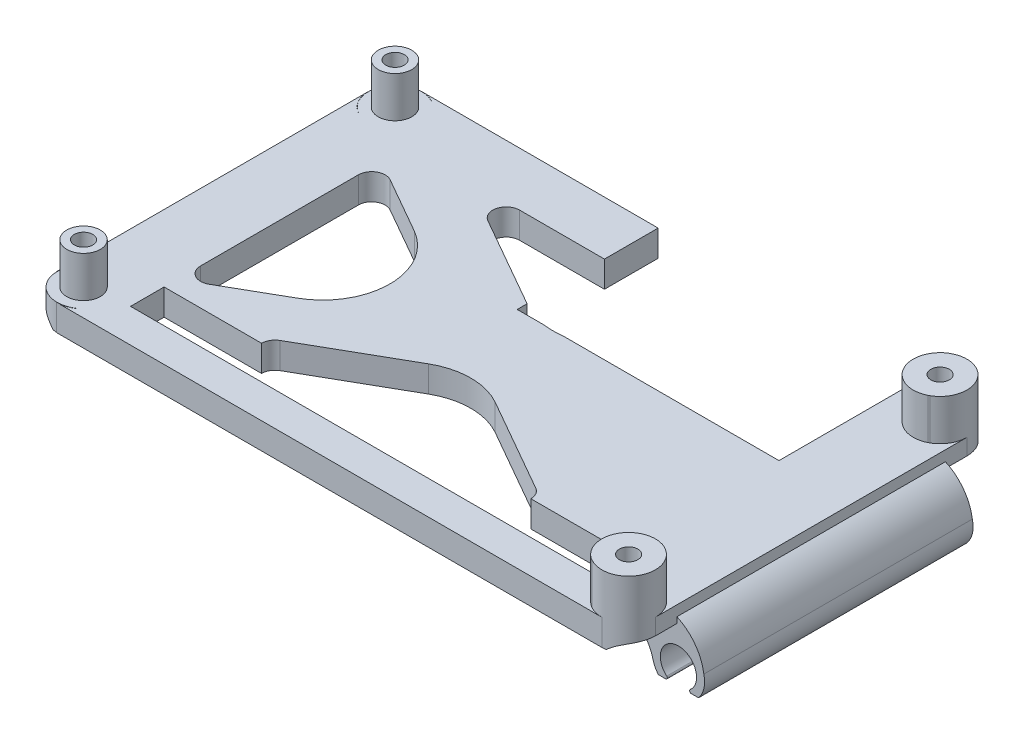
from build123d import *
from build123d.topology import SkipClean

# Parameters (mm, degrees)
EXTRUDE_1_DEPTH                            = 3.9
EXTRUDE_2_DEPTH                            = 10
EXTRUDE_3_DEPTH                            = 20
EXTRUDE_5_DEPTH                            = 20
FILLET_1_R                                 = 0.25
FILLET_1_OF_MIRROR_2_R                     = 0.25
SKETCH_7_R                                 = 5.5
CUT_EXTRUDE_3_DEPTH                        = 69.568655998
MIRROR_3_AT_THE_SECOND_PLANE_COPY_1_SKET_R = 5.5
MIRROR_3_AT_THE_SECOND_PLANE_COPY_1_DEPTH  = 69.568655998
SKETCH_8_W                                 = 70.7
SKETCH_8_H                                 = 5
CUT_EXTRUDE_4_DEPTH                        = 10
SKETCH_10_R                                = 1.375
CUT_EXTRUDE_5_DEPTH                        = 4
SKETCH_11_R                                = 1.375
CUT_EXTRUDE_6_DEPTH                        = 4
CUT_EXTRUDE_START                          = -6.1
SKETCH_12_R                                = 4
SKETCH_12_R_2                              = 2.5
CUT_EXTRUDE_7_DEPTH                        = 6.1


# Read off the part's stored shape, not the designer's step: Бобышка-Вытянуть2
with BuildPart() as part:
    # Эскиз1 → Бобышка-Вытянуть1 (new body)
    with BuildSketch(Plane(origin=(0, 0, 0), x_dir=(1, 0, 0), z_dir=(0, 1, 0))):
        with BuildLine():
            ThreePointArc((38.426306594, 26.557835162), (39.466717301, 27.036100927), (40.6, 27.2))
            Line((40.6, 27.2), (33.6, 27.2))
            Line((33.6, 27.2), (33.6, 14.604632239))
            Line((33.6, 14.604632239), (33.6, 6.2))
            Line((33.6, 6.2), (1.399354729, 6.2))
            ThreePointArc((1.399354729, 6.2), (0.006924966, 6.102582459), (-1.385504796, 6.2))
            Line((-1.385504796, 6.2), (-5.4, 6.2))
            Line((-5.4, 6.2), (-5.4, 7.674742799))
            Line((-5.4, 7.674742799), (-19.030349104, 15.463513716))
            ThreePointArc((-19.030349104, 15.463513716), (-19.971070525, 17.71333587), (-18.038071227, 19.2))
            Line((-18.038071227, 19.2), (-5.654645622, 19.2))
            Line((-5.654645622, 19.2), (-5.4, 19.2))
            Line((-5.4, 19.2), (-5.4, 27.2))
            Line((-5.4, 27.2), (-40.6, 27.2))
            ThreePointArc((-40.6, 27.2), (-39.40357152, 27.016878161), (-38.316689133, 26.484279447))
            ThreePointArc((-38.316689133, 26.484279447), (-37.055056879, 25.052937739), (-36.6, 23.2))
            ThreePointArc((-36.6, 23.2), (-38.441442008, 19.832415198), (-42.270313698, 19.565436457))
            ThreePointArc((-42.270313698, 19.565436457), (-43.967584802, 21.041442008), (-44.6, 23.2))
            Line((-44.6, 23.2), (-44.6, -23.2))
            ThreePointArc((-44.6, -23.2), (-43.898463936, -20.937228323), (-42.039932168, -19.468164614))
            ThreePointArc((-42.039932168, -19.468164614), (-38.337228323, -19.901536064), (-36.6, -23.2))
            ThreePointArc((-36.6, -23.2), (-36.999332896, -24.942181508), (-38.117598203, -26.336507822))
            ThreePointArc((-38.117598203, -26.336507822), (-39.285852232, -26.977964484), (-40.6, -27.2))
            Line((-40.6, -27.2), (40.6, -27.2))
            ThreePointArc((40.6, -27.2), (39.40357152, -27.016878161), (38.316689133, -26.484279447))
            ThreePointArc((38.316689133, -26.484279447), (37.127027431, -21.215444247), (42.270313698, -19.565436457))
            ThreePointArc((42.270313698, -19.565436457), (43.967584802, -21.041442008), (44.6, -23.2))
            Line((44.6, -23.2), (44.6, 23.2))
            ThreePointArc((44.6, 23.2), (44.004288219, 21.099804362), (42.394589141, 19.625164365))
            ThreePointArc((42.394589141, 19.625164365), (37.128485762, 21.212894343), (38.426306594, 26.557835162))
        make_face()
        with BuildLine():
            Line((-34.6, -11.764543277), (-34.6, 11.736040701))
            ThreePointArc((-34.6, 11.736040701), (-33.603853636, 13.465860887), (-31.607722123, 13.472526985))
            Line((-31.607722123, 13.472526985), (-23.204254649, 8.670545572))
            ThreePointArc((-23.204254649, 8.670545572), (-18.165644258, -0.009764783), (-23.200571892, -8.692211802))
            Line((-23.200571892, -8.692211802), (-31.606985572, -13.500608467))
            ThreePointArc((-31.606985572, -13.500608467), (-33.603486707, -13.494576348), (-34.6, -11.764543277))
        make_face(mode=Mode.SUBTRACT)
        with BuildLine():
            Line((-5.654645622, -19.2), (-18.078829772, -19.2))
            ThreePointArc((-18.078829772, -19.2), (-20.011937899, -17.712925891), (-19.070370981, -15.46309297))
            Line((-19.070370981, -15.46309297), (-4.97114598, -7.414324467))
            ThreePointArc((-4.97114598, -7.414324467), (-0.011319049, -6.098859843), (4.947949446, -7.416428197))
            Line((4.947949446, -7.416428197), (19.030349104, -15.463513716))
            ThreePointArc((19.030349104, -15.463513716), (19.971070525, -17.71333587), (18.038071227, -19.2))
            Line((18.038071227, -19.2), (4.894026582, -19.2))
            Line((4.894026582, -19.2), (-5.654645622, -19.2))
        make_face(mode=Mode.SUBTRACT)
    extrude(amount=EXTRUDE_1_DEPTH)

    # Бобышка-Вытянуть2 outline → Бобышка-Вытянуть2 (add)
    with BuildSketch(Plane(origin=(0, 0, 0), x_dir=(1, 0, 0), z_dir=(0, 1, 0))):
        with BuildLine():
            ThreePointArc((-42.607209829, -19.79264258), (-44.020115702, -25.185392776), (-38.636505369, -26.632734292))
            Line((-38.636505369, -26.632734292), (-38.117598203, -26.336507822))
            ThreePointArc((-38.117598203, -26.336507822), (-37.126497396, -21.216372096), (-42.039932168, -19.468164614))
            Line((-42.039932168, -19.468164614), (-42.607209829, -19.79264258))
        make_face()
        with BuildLine():
            ThreePointArc((38.426306594, 26.557835162), (37.128485762, 21.212894342), (42.394589141, 19.625164365))
            Line((42.394589141, 19.625164365), (42.583191096, 19.732830813))
            ThreePointArc((42.583191096, 19.732830813), (44.05455341, 25.20508599), (38.573099365, 26.641799371))
            Line((38.573099365, 26.641799371), (38.426306594, 26.557835162))
        make_face()
        with BuildLine():
            Line((-42.576812283, 19.740578505), (-42.270313698, 19.565436457))
            ThreePointArc((-42.270313698, 19.565436457), (-37.127027432, 21.215444247), (-38.316689133, 26.484279447))
            Line((-38.316689133, 26.484279447), (-38.623187717, 26.659421495))
            ThreePointArc((-38.623187717, 26.659421495), (-44.059421495, 25.176812283), (-42.576812283, 19.740578505))
        make_face()
        with BuildLine():
            Line((38.316689133, -26.484279447), (38.623187717, -26.659421495))
            ThreePointArc((38.623187717, -26.659421495), (44.059421495, -25.176812283), (42.576812283, -19.740578505))
            Line((42.576812283, -19.740578505), (42.270313698, -19.565436457))
            ThreePointArc((42.270313698, -19.565436457), (37.127027431, -21.215444247), (38.316689133, -26.484279447))
        make_face()
    extrude(amount=EXTRUDE_2_DEPTH)



with BuildPart() as body_2:
    # Эскиз3 → Бобышка-Вытянуть3 (new, symmetric)
    with BuildSketch(Plane.XY):
        with BuildLine():
            Line((-47.815262386, -6.499919999), (-45.841869662, -6.499919999))
            ThreePointArc((-45.841869662, -6.499919999), (-44.821869662, -1.3), (-43.801869662, -6.499919999))
            Line((-43.801869662, -6.499919999), (-41.828476938, -6.499919999))
            ThreePointArc((-41.828476938, -6.499919999), (-44.821869662, -0.1), (-47.815262386, -6.499919999))
        make_face()
    extrude_3 = extrude(amount=EXTRUDE_3_DEPTH, both=True)


with BuildPart() as part_1:
    with SkipClean():  # the faces are left unmerged after this step: merging them gives an invalid solid
        add(part.part)

        add(body_2.part)  # Бобышка-Вытянуть5 merges body 2
        # Эскиз5 → Бобышка-Вытянуть5 (add, symmetric)
        with BuildSketch(Plane.XY):
            with BuildLine():
                Line((-36.641600827, 0.870983001), (-34.6, 0))
                ThreePointArc((-34.6, 0), (-38.684888017, -1.351535806), (-41.039960555, -4.952451312))
                Line((-41.039960555, -4.952451312), (-42.295442046, -4.952451312))
                ThreePointArc((-42.295442046, -4.952451312), (-44.821869662, -1.3), (-47.348297278, -4.952451312))
                Line((-47.348297278, -4.952451312), (-48.60377877, -4.952451312))
                ThreePointArc((-48.60377877, -4.952451312), (-44.732839073, 2.293818231), (-36.641600827, 0.870983001))
            make_face()
        extrude_5 = extrude(amount=EXTRUDE_5_DEPTH, both=True)

    # Скругление1
    fillet_1_edges = [part_1.edges().sort_by_distance(p)[0] for p in [
        (-45.841869662, -6.499919999, 0),
        (-43.801869662, -6.499919999, 0),
    ]]
    fillet(fillet_1_edges, radius=FILLET_1_R)

    # Зеркальное отражение1: Бобышка-Вытянуть5 across plane
    with SkipClean():  # the faces are left unmerged after this step: merging them gives an invalid solid
        add(extrude_5.mirror(Plane(origin=(0, 0, 0), x_dir=(0, 0, 1), z_dir=(1, 0, 0))))

    # Зеркальное отражение2: Бобышка-Вытянуть3 across plane
    with SkipClean():  # the faces are left unmerged after this step: merging them gives an invalid solid
        add(extrude_3.mirror(Plane(origin=(0, 0, 0), x_dir=(0, 0, 1), z_dir=(1, 0, 0))))

    # Скругление1 of Зеркальное отражение2
    fillet_1_of_mirror_2_edges = [part_1.edges().sort_by_distance(p)[0] for p in [
        (45.841869662, -6.499919999, 0),
        (43.801869662, -6.499919999, 0),
    ]]
    fillet(fillet_1_of_mirror_2_edges, radius=FILLET_1_OF_MIRROR_2_R)

    # Эскиз7 → Вырез-Вытянуть3 (cut, through all)
    with SkipClean():  # the faces are left unmerged after this step: merging them gives an invalid solid
        with BuildSketch(Plane.XY.offset(20)):
            with Locations((-45, -4)):
                Circle(SKETCH_7_R)
        cut_extrude_3 = extrude(amount=CUT_EXTRUDE_3_DEPTH, mode=Mode.SUBTRACT)

    # Зеркальное отражение3: Вырез-Вытянуть3 across plane
    with SkipClean():  # the faces are left unmerged after this step: merging them gives an invalid solid
        add(cut_extrude_3.mirror(Plane(origin=(0, 0, 0), x_dir=(0, 0, 1), z_dir=(1, 0, 0))), mode=Mode.SUBTRACT)

    # Зеркальное отражение3 at the second plane: Вырез-Вытянуть3 across plane
    with SkipClean():  # the faces are left unmerged after this step: merging them gives an invalid solid
        add(cut_extrude_3.mirror(Plane.XY), mode=Mode.SUBTRACT)

    # Зеркальное отражение3 at the second plane copy 1 sket → Зеркальное отражение3 at the second plane copy 1 (cut, through all)
    with SkipClean():  # the faces are left unmerged after this step: merging them gives an invalid solid
        with BuildSketch(Plane(origin=(0, 0, -20), x_dir=(-1, 0, 0), z_dir=(0, 0, -1))):
            with Locations((-45, -4)):
                Circle(MIRROR_3_AT_THE_SECOND_PLANE_COPY_1_SKET_R)
        extrude(amount=MIRROR_3_AT_THE_SECOND_PLANE_COPY_1_DEPTH, mode=Mode.SUBTRACT)

    # Эскиз8 → Вырез-Вытянуть4 (cut)
    with SkipClean():  # the faces are left unmerged after this step: merging them gives an invalid solid
        with BuildSketch(Plane(origin=(0, 3.9, 0), x_dir=(1, 0, 0), z_dir=(0, 1, 0))):
            with Locations((0.75, -19.7)):
                Rectangle(SKETCH_8_W, SKETCH_8_H)
        extrude(amount=-CUT_EXTRUDE_4_DEPTH, mode=Mode.SUBTRACT)

    # Эскиз10 → Вырез-Вытянуть5 (cut)
    with SkipClean():  # the faces are left unmerged after this step: merging them gives an invalid solid
        with BuildSketch(Plane(origin=(0, 10, 0), x_dir=(1, 0, 0), z_dir=(0, 1, 0))):
            with Locations(Location((-40.6, 23.2, 0), (0, 0, 270))):
                Circle(SKETCH_10_R)
        extrude(amount=-CUT_EXTRUDE_5_DEPTH, mode=Mode.SUBTRACT)

    # Эскиз11 → Вырез-Вытянуть6 (cut)
    with SkipClean():  # the faces are left unmerged after this step: merging them gives an invalid solid
        with BuildSketch(Plane(origin=(0, 10, 0), x_dir=(1, 0, 0), z_dir=(0, 1, 0))):
            with Locations(Location((-40.6, -23.2, 0), (0, 0, 270))):
                Circle(SKETCH_11_R)
            with Locations(Location((40.6, -23.2, 0), (0, 0, 270))):
                Circle(SKETCH_11_R)
            with Locations(Location((40.6, 23.2, 0), (0, 0, 270))):
                Circle(SKETCH_11_R)
        extrude(amount=-CUT_EXTRUDE_6_DEPTH, mode=Mode.SUBTRACT)

    # Эскиз12 → Вырез-Вытянуть7 (cut)
    # profile 1 of 2: a face of its own
    with SkipClean():  # the faces are left unmerged after this step: merging them gives an invalid solid
        with BuildSketch(Plane(origin=(0, 10, 0), x_dir=(1, 0, 0), z_dir=(0, 1, 0)).offset(CUT_EXTRUDE_START)):
            with Locations((-40.6, 23.2)):
                Circle(SKETCH_12_R)
            with Locations(Location((-40.6, 23.2, 0), (0, 0, 270))):
                Circle(SKETCH_12_R_2, mode=Mode.SUBTRACT)
        # profile 2 of 2: a face of its own
        with BuildSketch(Plane(origin=(0, 10, 0), x_dir=(1, 0, 0), z_dir=(0, 1, 0)).offset(CUT_EXTRUDE_START)):
            with Locations((-40.6, -23.2)):
                Circle(SKETCH_12_R)
            with Locations(Location((-40.6, -23.2, 0), (0, 0, 270))):
                Circle(SKETCH_12_R_2, mode=Mode.SUBTRACT)
        extrude(amount=CUT_EXTRUDE_7_DEPTH, mode=Mode.SUBTRACT)


solid = part_1.part
